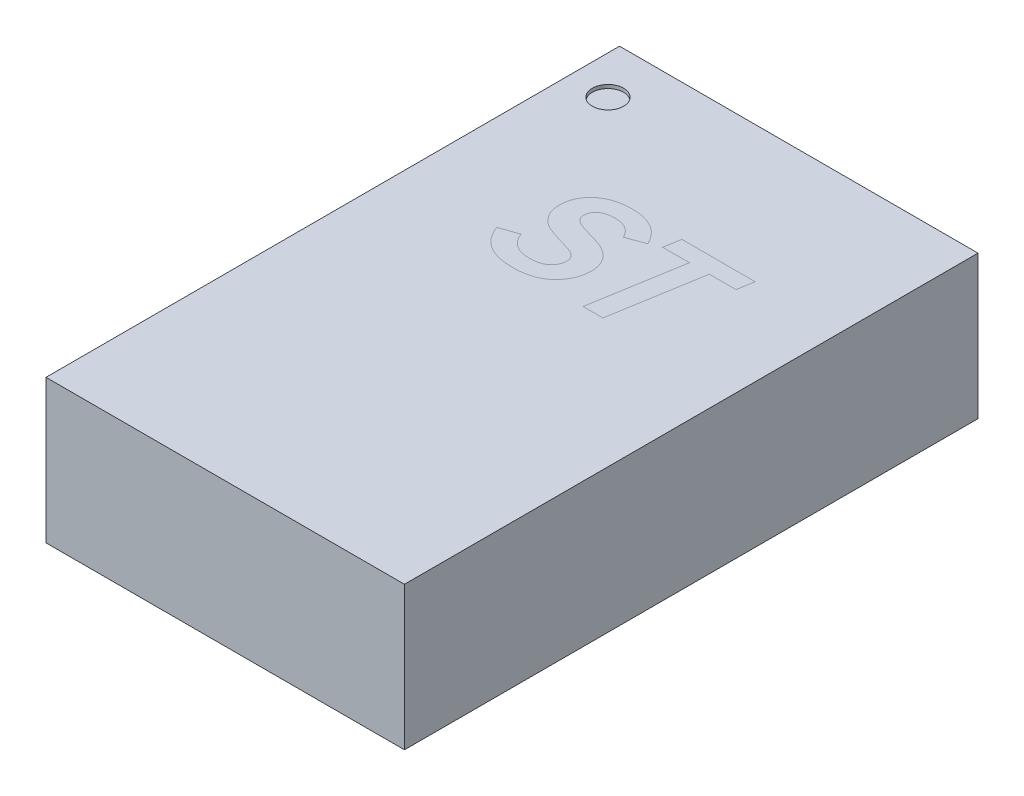
from build123d import *

# Parameters (mm, degrees)
SKETCH_1_W          = 1
SKETCH_1_H          = 1.6
EXTRUDE_1_DEPTH     = 0.4
SKETCH_2_R          = 0.043627365
CUT_EXTRUDE_1_DEPTH = 0.01
SKETCH_3_W          = 0.2
SKETCH_3_H          = 0.2
EXTRUDE_2_DEPTH     = 0.01


with BuildPart() as part:
    # Эскиз1 → Бобышка-Вытянуть1 (new body)
    with BuildSketch(Plane(origin=(0, 0, 0), x_dir=(1, 0, 0), z_dir=(0, 1, 0))):
        Rectangle(SKETCH_1_W, SKETCH_1_H)
    extrude(amount=EXTRUDE_1_DEPTH)

    # Эскиз2 → Вырез-Вытянуть1 (cut)
    with BuildSketch(Plane(origin=(0, 0.4, 0), x_dir=(1, 0, 0), z_dir=(0, 1, 0))):
        with Locations((-0.392835402, 0.660583741)):
            Circle(SKETCH_2_R)
    extrude(amount=-CUT_EXTRUDE_1_DEPTH, mode=Mode.SUBTRACT)

    # Эскиз3 → Бобышка-Вытянуть2 (add)
    with BuildSketch(Plane.XZ):
        with Locations((-0.25, -0.587)):
            Rectangle(SKETCH_3_W, SKETCH_3_H)
        with Locations((0.25, -0.587)):
            Rectangle(SKETCH_3_W, SKETCH_3_H)
        with Locations((0.25, 0.003)):
            Rectangle(SKETCH_3_W, SKETCH_3_H)
        with Locations((0.25, 0.593)):
            Rectangle(SKETCH_3_W, SKETCH_3_H)
        with Locations((-0.25, 0.003)):
            Rectangle(SKETCH_3_W, SKETCH_3_H)
        with Locations((-0.25, 0.593)):
            Rectangle(SKETCH_3_W, SKETCH_3_H)
    extrude(amount=EXTRUDE_2_DEPTH)


solid = part.part
